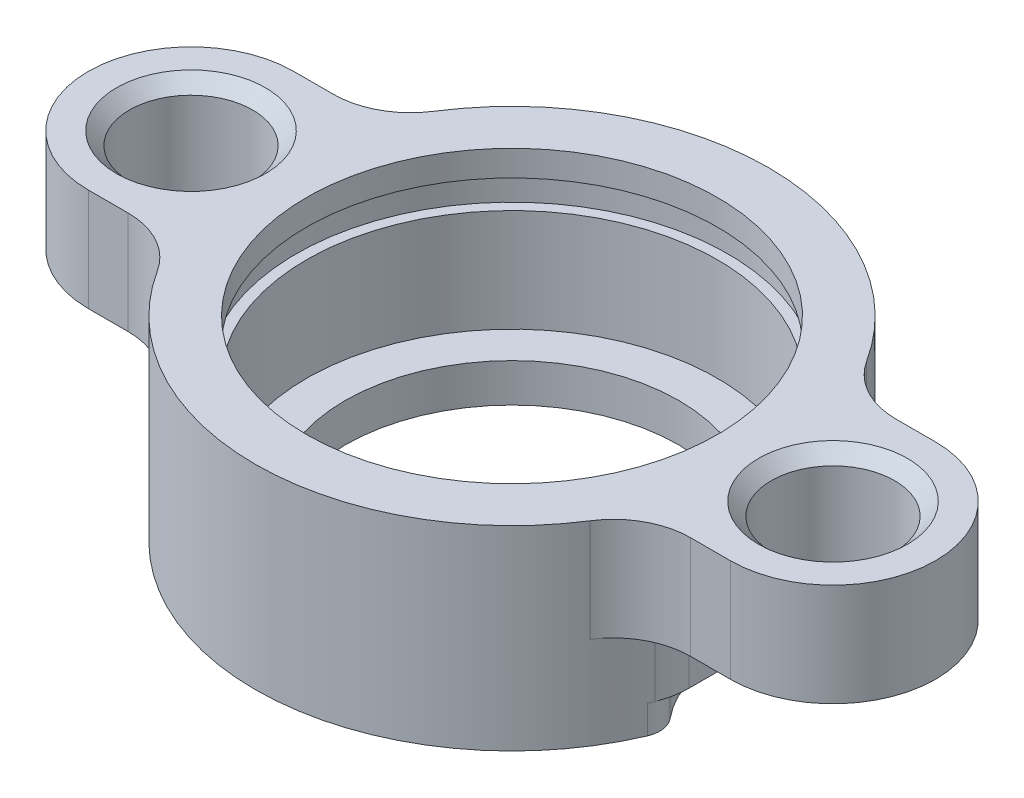
from build123d import *

# Parameters (mm, degrees)
BOSS_EXTRU_1_DEPTH             = 4
ENL_V_START                    = -4
ENL_V_MAT_EXTRU_3_DEPTH        = 3.6
CONG_2_R                       = 3
CONG_3_R                       = 3
CONG_2_OF_SYM_TRIE1_R          = 3
CONG_3_OF_SYM_TRIE1_R          = 3
F_4_8_4_8_DIAMETER_HOLE2_D     = 4.8
F_4_8_4_8_DIAMETER_HOLE2_DEPTH = 6.4
F_4_8_4_8_DIAMETER_HOLE2_TIP   = 1.442065486
CHANFREIN1_SIZE                = 0.5
ESQUISSE9_R                    = 4.5
ENL_V_MAT_EXTRU_4_DEPTH        = 1.1
CONG_4_R                       = 1


with BuildPart() as part:
    # Esquisse1 → Révolution1 (revolve)
    with BuildSketch(Plane.XY, mode=Mode.PRIVATE) as r_volution1_sk:
        Polygon((-6.5, -4), (-6.5, -5.5), (-10, -5.5), (-10, 2.1), (-8, 2.1), (-8, 1.1), (-8.4, 1.1), (-8.4, 0), (-8, 0), (-8, -4), align=None)
    revolve(r_volution1_sk.sketch.rotate(Axis((0, 6.608552154, 0), (0, -1, 0)), 270), axis=Axis((0, 6.608552154, 0), (0, -1, 0)))

    # Esquisse2 → Boss.-Extru.1 (add)
    with BuildSketch(Plane(origin=(0, 2.1, 0), x_dir=(1, 0, 0), z_dir=(0, 1, 0))):
        with BuildLine():
            Line((-12.5, -4), (-9.16515139, -4))
            ThreePointArc((-9.16515139, -4), (-10, 0), (-9.16515139, 4))
            Line((-9.16515139, 4), (-12.5, 4))
            ThreePointArc((-12.5, 4), (-16.5, 0), (-12.5, -4))
        make_face()
    boss_extru_1 = extrude(amount=-BOSS_EXTRU_1_DEPTH)

    # Esquisse2<6> → Enlèv. mat.-Extru.3 (cut)
    with BuildSketch(Plane(origin=(0, 2.1, 0), x_dir=(1, 0, 0), z_dir=(0, 1, 0)).offset(ENL_V_START)):
        with BuildLine():
            ThreePointArc((-9.5, 3.122498999), (-10, 0), (-9.5, -3.122498999))
            Line((-9.5, -3.122498999), (-9.5, 3.122498999))
        make_face()
    enl_v_mat_extru_3 = extrude(amount=-ENL_V_MAT_EXTRU_3_DEPTH, mode=Mode.SUBTRACT)

    # Congé2
    cong_2_edges = [part.edges().sort_by_distance(p)[0] for p in [
        (-9.5, -3.7, 3.122498999),
        (-9.5, -3.7, -3.122498999),
    ]]
    fillet(cong_2_edges, radius=CONG_2_R)

    # Congé3
    cong_3_edges = [part.edges().sort_by_distance(p)[0] for p in [
        (-9.16515139, 0.1, -4),
        (-9.16515139, 0.1, 4),
    ]]
    fillet(cong_3_edges, radius=CONG_3_R)

    # Symétrie1: Boss.-Extru.1, Enlèv. mat.-Extru.3 across plane
    add(boss_extru_1.mirror(Plane(origin=(0, 0, 0), x_dir=(0, 0, 1), z_dir=(1, 0, 0))))
    add(enl_v_mat_extru_3.mirror(Plane(origin=(0, 0, 0), x_dir=(0, 0, 1), z_dir=(1, 0, 0))), mode=Mode.SUBTRACT)

    # Congé2 of Symétrie1
    cong_2_of_sym_trie1_edges = [part.edges().sort_by_distance(p)[0] for p in [
        (9.5, -3.7, 3.122498999),
        (9.5, -3.7, -3.122498999),
    ]]
    fillet(cong_2_of_sym_trie1_edges, radius=CONG_2_OF_SYM_TRIE1_R)

    # Congé3 of Symétrie1
    cong_3_of_sym_trie1_edges = [part.edges().sort_by_distance(p)[0] for p in [
        (9.16515139, 0.1, -4),
        (9.16515139, 0.1, 4),
    ]]
    fillet(cong_3_of_sym_trie1_edges, radius=CONG_3_OF_SYM_TRIE1_R)

    # Ø4.8 (4.8) Diameter Hole2
    with Locations(Plane(origin=(0, 2.1, 0), x_dir=(1, 0, 0), z_dir=(0, 1, 0))):
        with Locations((-12.5, 0), (12.5, 0)):
            Hole(F_4_8_4_8_DIAMETER_HOLE2_D / 2, depth=F_4_8_4_8_DIAMETER_HOLE2_DEPTH)
            with Locations((0, 0, -(F_4_8_4_8_DIAMETER_HOLE2_DEPTH + F_4_8_4_8_DIAMETER_HOLE2_TIP / 2))):  # 118° drill point
                Cone(0, F_4_8_4_8_DIAMETER_HOLE2_D / 2, F_4_8_4_8_DIAMETER_HOLE2_TIP, mode=Mode.SUBTRACT)

    # Chanfrein1
    chanfrein1_edges = [part.edges().sort_by_distance(p)[0] for p in [
        (14.9, 2.1, 0),
        (-10.1, 2.1, 0),
    ]]
    chamfer(chanfrein1_edges, length=CHANFREIN1_SIZE)

    # Esquisse9 → Enlèv. mat.-Extru.4 (cut)
    with BuildSketch(Plane.XZ.offset(5.5)):
        with Locations((-12.5, 0)):
            Circle(ESQUISSE9_R)
        with Locations((12.5, 0)):
            Circle(ESQUISSE9_R)
    extrude(amount=-ENL_V_MAT_EXTRU_4_DEPTH, mode=Mode.SUBTRACT)

    # Congé4
    # the kernel refuses this fillet: 1 mm, written as the material it takes off along each edge
    with BuildSketch(Plane(origin=(9.421052632, -4.4, 3.281780477), x_dir=(-0.686560042836171, 0, -0.7270731102033653), z_dir=(0, -1, 0))) as cong_4_piece_1:
        with BuildLine():
            CenterArc((0.604915781, -0.998168708), CONG_4_R, 93.468029374, 62.964308211)
            Line((-0.311672758, -0.598336932), (-0.403331612, -0.558353754))
            ThreePointArc((-0.403331612, -0.558353754), (-0.310284429, -0.351422835), (-0.083419367, 0.05514716))
            Line((-0.083419367, 0.05514716), (0.006049158, 0.099816871))
            ThreePointArc((0.006049158, 0.099816871), (0.272212102, 0.091759185), (0.538375045, 0.099816871))
            Line((0.538375045, 0.099816871), (0.544424203, 0))
        make_face()
    extrude(amount=2.786614567, mode=Mode.SUBTRACT)
    with BuildSketch(Plane(origin=(9.421052632, -4.4, -3.281780477), x_dir=(-0.6865600428361709, 0, 0.7270731102033654), z_dir=(0, -1, 0)), Plane(origin=(-9.421052632, -4.4, 3.281780477), x_dir=(0.6865600428361707, 0, -0.7270731102033658), z_dir=(0, -1, 0))) as cong_4_piece_2:
        with BuildLine():
            CenterArc((0.604915781, 0.998168708), CONG_4_R, 203.567662416, 62.964308211)
            Line((-0.311672758, 0.598336932), (-0.403331612, 0.558353754))
            ThreePointArc((-0.403331612, 0.558353754), (-0.310284429, 0.351422835), (-0.083419367, -0.05514716))
            Line((-0.083419367, -0.05514716), (0.006049158, -0.099816871))
            ThreePointArc((0.006049158, -0.099816871), (0.272212102, -0.091759185), (0.538375045, -0.099816871))
            Line((0.538375045, -0.099816871), (0.544424203, 0))
        make_face()
    extrude(amount=2.786614567, mode=Mode.SUBTRACT)
    with BuildSketch(Plane(origin=(-9.421052632, -4.4, -3.281780477), x_dir=(0.3276573021844398, 0, -0.9447966407249841), z_dir=(0, -1, 0))) as cong_4_piece_3:
        with BuildLine():
            CenterArc((0.605807396, 0.997627822), CONG_4_R, 210.982965052, 62.964308211)
            Line((-0.251512996, 0.482844619), (-0.337245035, 0.431366299))
            ThreePointArc((-0.337245035, 0.431366299), (-0.207136841, 0.199031418), (-0.091321217, -0.04074844))
            Line((-0.091321217, -0.04074844), (-0.010371424, -0.099460714))
            ThreePointArc((-0.010371424, -0.099460714), (0.455018696, -0.112838034), (0.68152967, -0.099762782))
            Line((0.68152967, -0.099762782), (0.674645827, 0))
        make_face()
    extrude(amount=2.786614567, mode=Mode.SUBTRACT)


solid = part.part
